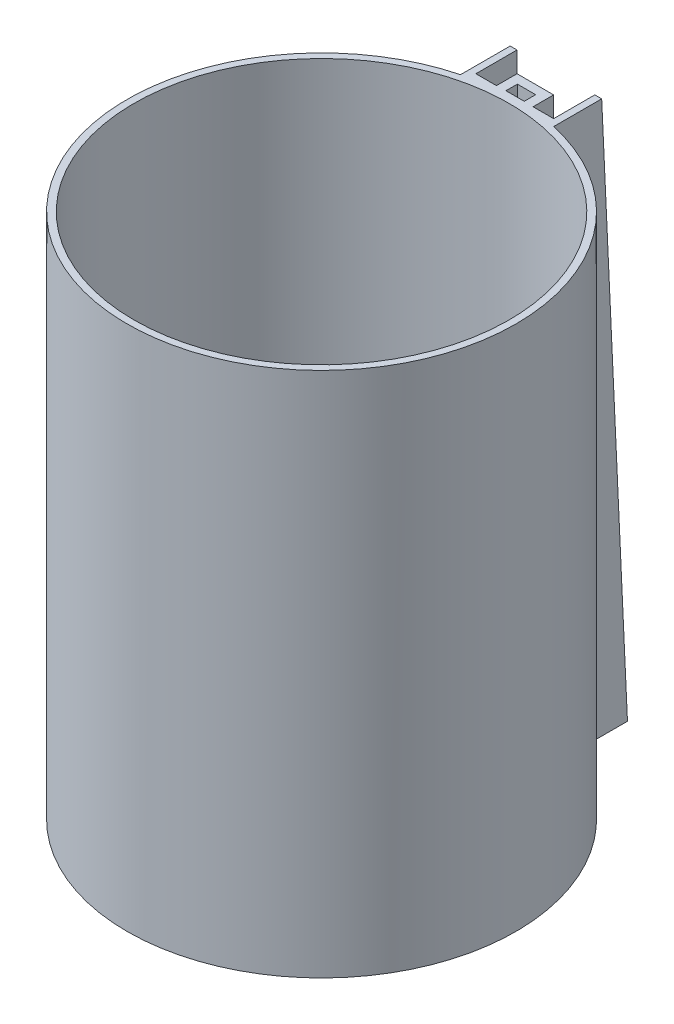
from build123d import *

# Parameters (mm, degrees)
SKETCH1_R           = 42.5
BOSS_EXTRUDE1_DEPTH = 115
SKETCH2_R           = 41
CUT_EXTRUDE3_DEPTH  = 115
SKETCH9_W           = 4.5
SKETCH9_H           = 9
CUT_EXTRUDE5_DEPTH  = 115
SKETCH14_W          = 4
SKETCH14_H          = 2.5
CUT_EXTRUDE8_DEPTH  = 115
SKETCH16_W          = 8
SKETCH16_H          = 4.5
CUT_EXTRUDE9_DEPTH  = 115
BOSS_EXTRUDE2_START = 1
SKETCH19_R          = 41
BOSS_EXTRUDE2_DEPTH = 1
SKETCH21_R          = 3
BOSS_EXTRUDE3_DEPTH = 50
SHELL1_T            = -0.3
SKETCH24_R          = 3
BOSS_EXTRUDE4_DEPTH = 35
SHELL2_START        = 19
SHELL2_OUTLINE_R    = 2.7
SHELL2_DEPTH        = 35
SKETCH25_R          = 3
BOSS_EXTRUDE5_DEPTH = 45
SHELL5_T            = -0.03
SKETCH26_W          = 30
SKETCH26_H          = 15
BOSS_EXTRUDE6_DEPTH = 5


# Read off the part's stored shape, not the designer's step: Shell2
with BuildPart() as part:
    # Sketch1 → Boss-Extrude1 (new body)
    with BuildSketch(Plane(origin=(0, 0, 0), x_dir=(1, 0, 0), z_dir=(0, 1, 0))):
        with Locations(Location((0, 0, 0), (0, 0, 270))):
            Circle(SKETCH1_R)
    extrude(amount=BOSS_EXTRUDE1_DEPTH)

    # Sketch7 → Loft2 section 0
    with BuildSketch(Plane.XZ):
        with BuildLine():
            Line((-15.1377027, -38.271634302), (14.891561193, -38.271634302))
            Line((14.891561193, -38.271634302), (14.891561193, -51.96970786))
            Line((14.891561193, -51.96970786), (-15.1377027, -51.96970786))
            Line((-15.1377027, -51.96970786), (-15.1377027, -38.271634302))
        make_face()
    # Sketch6 → Loft2 section 1
    with BuildSketch(Plane(origin=(0, 115, 0), x_dir=(1, 0, 0), z_dir=(0, 1, 0))):
        with BuildLine():
            Line((-10.741203576, 39.96970786), (9.258796424, 39.96970786))
            Line((9.258796424, 39.96970786), (9.258796424, 51.96970786))
            Line((9.258796424, 51.96970786), (-10.741203576, 51.96970786))
            Line((-10.741203576, 51.96970786), (-10.741203576, 39.96970786))
        make_face()
    loft()

    # Sketch2 → Cut-Extrude3 (cut)
    with BuildSketch(Plane(origin=(0, 115, 0), x_dir=(1, 0, 0), z_dir=(0, 1, 0))):
        with Locations(Location((0, 0, 0), (0, 0, 270))):
            Circle(SKETCH2_R)
    extrude(amount=-CUT_EXTRUDE3_DEPTH, mode=Mode.SUBTRACT)

    # Sketch9 → Cut-Extrude5 (cut)
    with BuildSketch(Plane(origin=(0, 115, 0), x_dir=(1, 0, 0), z_dir=(0, 1, 0))):
        with Locations((-6.991203576, 47.46970786)):
            Rectangle(SKETCH9_W, SKETCH9_H)
        with Locations((5.508796424, 47.46970786)):
            Rectangle(SKETCH9_W, SKETCH9_H)
    extrude(amount=-CUT_EXTRUDE5_DEPTH, mode=Mode.SUBTRACT)

    # Sketch14 → Cut-Extrude8 (cut)
    with BuildSketch(Plane(origin=(0, 115, 0), x_dir=(1, 0, 0), z_dir=(0, 1, 0))):
        with Locations((-0.741203576, 44.290749204)):
            Rectangle(SKETCH14_W, SKETCH14_H)
    extrude(amount=-CUT_EXTRUDE8_DEPTH, mode=Mode.SUBTRACT)

    # Sketch16 → Cut-Extrude9 (cut)
    with BuildSketch(Plane(origin=(0, 115, 0), x_dir=(1, 0, 0), z_dir=(0, 1, 0))):
        with Locations((-0.741203576, 49.71970786)):
            Rectangle(SKETCH16_W, SKETCH16_H)
    extrude(amount=-CUT_EXTRUDE9_DEPTH, mode=Mode.SUBTRACT)

    # Sketch19 → Boss-Extrude2 (add)
    with BuildSketch(Plane(origin=(0, 54, 0), x_dir=(1, 0, 0), z_dir=(0, 1, 0)).offset(BOSS_EXTRUDE2_START)):
        with Locations(Location((0, 0, 0), (0, 0, 270))):
            Circle(SKETCH19_R)
    extrude(amount=-BOSS_EXTRUDE2_DEPTH)

    # Sketch21 → Boss-Extrude3 (add)
    with BuildSketch(Plane.XZ.offset(-54)):
        with Locations(Location((-35.3, 0, 0), (0, 0, 90))):
            Circle(SKETCH21_R)
        with Locations(Location((35.3, 0, 0), (0, 0, 90))):
            Circle(SKETCH21_R)
    extrude(amount=BOSS_EXTRUDE3_DEPTH)

    # Shell1
    shell1_openings = [part.faces().sort_by_distance(p)[0] for p in [
        (-35.3, 4, 0),
        (35.3, 4, 0),
    ]]
    offset(amount=SHELL1_T, openings=shell1_openings, kind=Kind.INTERSECTION)

    # Sketch24 → Boss-Extrude4 (add)
    with BuildSketch(Plane.XZ.offset(-54)):
        with Locations(Location((7.5, 30, 0), (0, 0, 90))):
            Circle(SKETCH24_R)
        with Locations(Location((-7.5, 30, 0), (0, 0, 90))):
            Circle(SKETCH24_R)
    extrude(amount=BOSS_EXTRUDE4_DEPTH)

    # Shell2 outline → Shell2 (cut)
    with BuildSketch(Plane(origin=(0, 0, 0), x_dir=(1, 0, 0), z_dir=(0, 1, 0)).offset(SHELL2_START)):
        with Locations((-7.5, -30)):
            Circle(SHELL2_OUTLINE_R)
        with Locations((7.5, -30)):
            Circle(SHELL2_OUTLINE_R)
    extrude(amount=SHELL2_DEPTH, mode=Mode.SUBTRACT)

    # Sketch25 → Boss-Extrude5 (add)
    with BuildSketch(Plane.XZ.offset(-54)):
        with Locations(Location((14, -32.5, 0), (0, 0, 90))):
            Circle(SKETCH25_R)
        with Locations(Location((-14, -32.5, 0), (0, 0, 90))):
            Circle(SKETCH25_R)
    extrude(amount=BOSS_EXTRUDE5_DEPTH)

    # Shell5
    shell5_openings = [part.faces().sort_by_distance(p)[0] for p in [
        (-14, 9, -32.5),
        (14, 9, -32.5),
    ]]
    offset(amount=SHELL5_T, openings=shell5_openings, kind=Kind.INTERSECTION)

    # Sketch26 → Boss-Extrude6 (add)
    with BuildSketch(Plane.XZ.offset(-54)):
        Rectangle(SKETCH26_W, SKETCH26_H)
    extrude(amount=BOSS_EXTRUDE6_DEPTH)


solid = part.part
